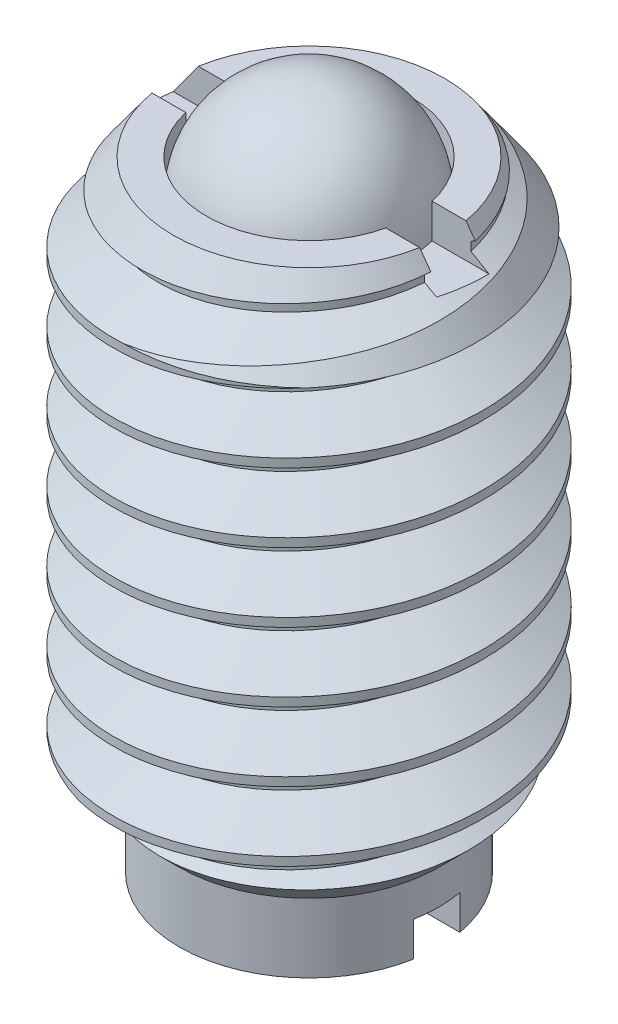
from build123d import *

# Parameters (mm, degrees)
SKETCH24_W               = 1.4224
SKETCH24_H               = 4.7498
CUT_SWEEP1_PITCH         = 0.529166667
SKETCH26_W               = 0.7874
SKETCH26_H               = 4.27482
CUT_EXTRUDE11_DEPTH      = 4.112329445
CUT_EXTRUDE11_DEPTH_BACK = 4.112329445
SKETCH28_W               = 0.3556
SKETCH28_H               = 0.264583333


with BuildPart() as part:
    # Sketch24 → Revolve1 (revolve)
    with BuildSketch(Plane(origin=(0, 0, 0), x_dir=(0, 0, -1), z_dir=(1, 0, 0)), mode=Mode.PRIVATE) as revolve1_sk:
        with Locations((0.7112, 0)):
            Rectangle(SKETCH24_W, SKETCH24_H)
    revolve(revolve1_sk.sketch.rotate(Axis((0, 2.3749, 0), (0, -1, 0)), 180), axis=Axis((0, 2.3749, 0), (0, -1, 0)))

    # Cut-Sweep1: the profile of Sketch38 profile screwed along a right-hand helix of 9.976 turns, 6 arcs to a turn; built about Z, then put on its axis
    cut_sweep1_z = Axis((0, 0, 0), (0, 0, 1))
    cut_sweep1_corners = [(1.4227, 0, -0.463194038), (1.4227, 0, 0.000173205), (1.078696168, 0, -0.1984375), (1.078696168, 0, -0.264583333)]
    with BuildLine(mode=Mode.PRIVATE) as cut_sweep1_profile:
        Line(cut_sweep1_corners[0], cut_sweep1_corners[1])
        Line(cut_sweep1_corners[1], cut_sweep1_corners[2])
        Line(cut_sweep1_corners[2], cut_sweep1_corners[3])
        Line(cut_sweep1_corners[3], cut_sweep1_corners[0])
    cut_sweep1_cap = Face(cut_sweep1_profile.wire())
    cut_sweep1_turn_angles = [0, 30, 60, 90, 120, 150, 180, 210, 240, 270, 300, 330, 360]
    cut_sweep1_turn_weights = [1, 0.8660254037844387, 1, 0.8660254037844387, 1, 0.8660254037844387, 1, 0.8660254037844387, 1, 0.8660254037844387, 1, 0.8660254037844387, 1]
    cut_sweep1_turn_rails = [Edge.make_bspline([Vector(p[0], p[1], 0).rotate(cut_sweep1_z, cut_sweep1_turn_angles[k]) / cut_sweep1_turn_weights[k] + Vector(0, 0, p[2] + CUT_SWEEP1_PITCH * cut_sweep1_turn_angles[k] / 360) for k in range(13)], [0, 0, 0, 1, 1, 2, 2, 3, 3, 4, 4, 5, 5, 6, 6, 6], 2, cut_sweep1_turn_weights) for p in cut_sweep1_corners]
    cut_sweep1_turn_sides = [Face.make_surface_from_curves(cut_sweep1_turn_rails[p[0]], cut_sweep1_turn_rails[p[1]]) for p in [(0, 1), (1, 2), (2, 3), (3, 0)]]
    cut_sweep1_last_angles = [3240, 3270, 3300, 3330, 3360, 3390, 3420, 3450, 3480, 3510, 3540, 3565.68, 3591.36]
    cut_sweep1_last_weights = [1, 0.8660254037844387, 1, 0.8660254037844387, 1, 0.8660254037844387, 1, 0.8660254037844387, 1, 0.8660254037844387, 1, 0.9012283419993867, 1]
    cut_sweep1_last_rails = [Edge.make_bspline([Vector(p[0], p[1], 0).rotate(cut_sweep1_z, cut_sweep1_last_angles[k]) / cut_sweep1_last_weights[k] + Vector(0, 0, p[2] + CUT_SWEEP1_PITCH * cut_sweep1_last_angles[k] / 360) for k in range(13)], [0, 0, 0, 1, 1, 2, 2, 3, 3, 4, 4, 5, 5, 6, 6, 6], 2, cut_sweep1_last_weights) for p in cut_sweep1_corners]
    cut_sweep1_last_sides = [Face.make_surface_from_curves(cut_sweep1_last_rails[p[0]], cut_sweep1_last_rails[p[1]]) for p in [(0, 1), (1, 2), (2, 3), (3, 0)]]
    cut_sweep1 = Plane(origin=(0, 2.3749, 0), x_dir=(0, 0, 1), z_dir=(0, -1, 0)) * Solid(Shell([*[p.moved(Location((0, 0, CUT_SWEEP1_PITCH * i))) for i in range(9) for p in cut_sweep1_turn_sides], *cut_sweep1_last_sides, cut_sweep1_cap, cut_sweep1_cap.rotate(cut_sweep1_z, 3591.36).moved(Location((0, 0, CUT_SWEEP1_PITCH * 3591.36 / 360)))]))
    add(cut_sweep1, mode=Mode.SUBTRACT)

    # Sketch26 → Cut-Revolve10 (revolve, cut)
    with BuildSketch(Plane(origin=(0, 0, 0), x_dir=(0, 0, -1), z_dir=(1, 0, 0))):
        with Locations((0.3937, 0.23749)):
            Rectangle(SKETCH26_W, SKETCH26_H)
    revolve(axis=Axis((0, -1.89992, 0), (0, 1, 0)), mode=Mode.SUBTRACT)

    # Sketch31 → Cut-Revolve13 (revolve, cut)
    with BuildSketch(Plane(origin=(0, 0, 0), x_dir=(0, 0, -1), z_dir=(1, 0, 0)), mode=Mode.PRIVATE) as cut_revolve13_sk:
        Polygon((1.4224, -2.3749), (0.99568, -2.3749), (0.99568, -1.845733333), (1.4224, -1.419013333), align=None)
        Polygon((1.4224, 2.3749), (1.0414, 2.3749), (1.4224, 1.845733333), align=None)
    revolve(cut_revolve13_sk.sketch.rotate(Axis((0, 2.3749, 0), (0, -1, 0)), 180), axis=Axis((0, 2.3749, 0), (0, -1, 0)), mode=Mode.SUBTRACT)

    # Sketch28 → Cut-Extrude11 (cut, two sides: drawn at the far end of the back side and taken through both)
    with BuildSketch(Plane(origin=(0, 0, 0), x_dir=(0, 0, -1), z_dir=(1, 0, 0)).offset(-CUT_EXTRUDE11_DEPTH_BACK)):
        with Locations((0, -2.242608334)):
            Rectangle(SKETCH28_W, SKETCH28_H)
        with Locations((0, 2.242608334)):
            Rectangle(SKETCH28_W, SKETCH28_H)
    extrude(amount=CUT_EXTRUDE11_DEPTH + CUT_EXTRUDE11_DEPTH_BACK, mode=Mode.SUBTRACT)


with BuildPart() as body_2:
    # Sketch27 → Revolve2 (revolve)
    with BuildSketch(Plane(origin=(0, 0, 0), x_dir=(0, 0, -1), z_dir=(1, 0, 0))):
        with BuildLine():
            Line((0, 2.8829), (0, 1.3081))
            ThreePointArc((0, 1.3081), (0.7874, 2.0955), (0, 2.8829))
        make_face()
    revolve(axis=Axis((0, 2.8829, 0), (0, -1, 0)))


solid = Compound([part.part, body_2.part])
